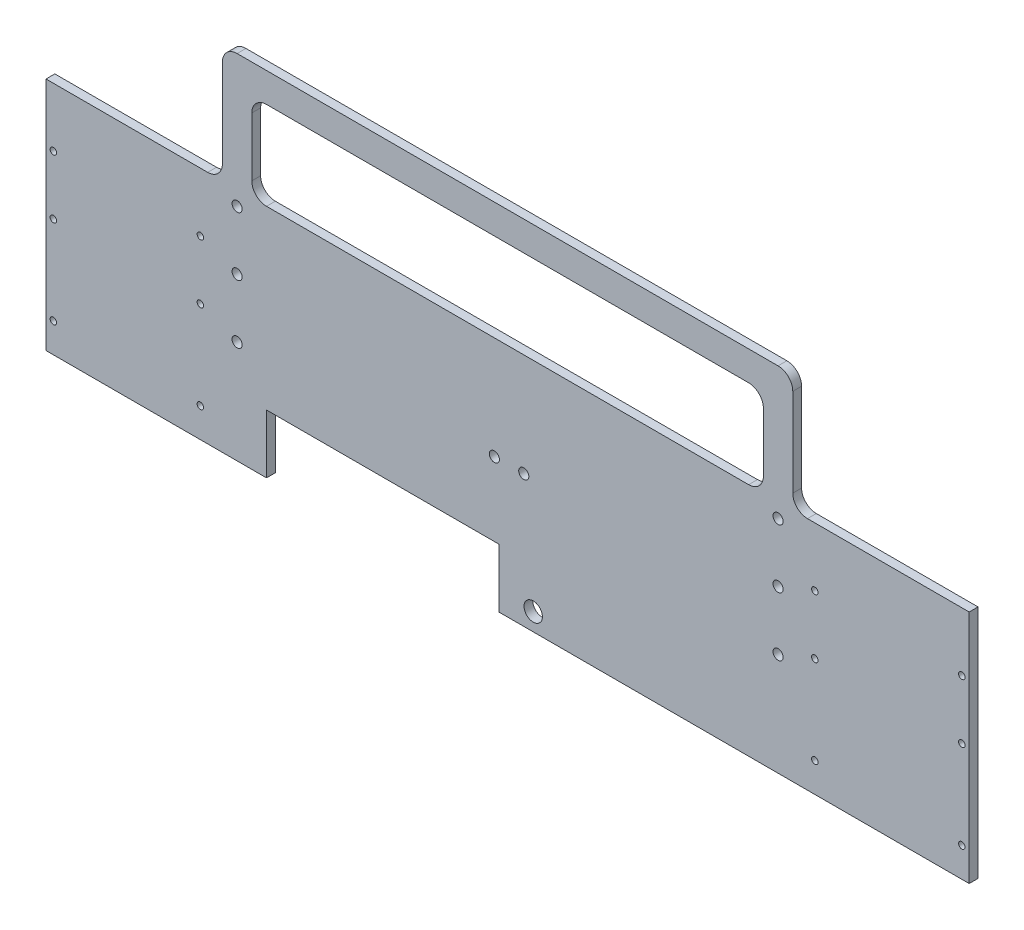
from build123d import *

# Parameters (mm, degrees)
SKETCH1_W                            = 398.78
SKETCH1_H                            = 101.6
BOSS_EXTRUDE1_DEPTH                  = 3.81
BOSS_EXTRUDE2_DEPTH                  = 3.81
FILLET1_R                            = 6.35
SKETCH11_W                           = 100.33
SKETCH11_H                           = 25.4
CUT_EXTRUDE1_DEPTH                   = 224.815656736
F_5_16_0_3125_DIAMETER_HOLE1_D       = 7.9375
F_11_64_0_17188_DIAMETER_HOLE1_D     = 4.365752
F_35_0_11_DIAMETER_HOLE1_D           = 2.794
F_35_0_11_DIAMETER_HOLE1_DEPTH       = 8.89
F_35_0_11_DIAMETER_HOLE1_TIP         = 0.839402285
F_11_64_0_17188_DIAMETER_HOLE2_D     = 4.365752
F_11_64_0_17188_DIAMETER_HOLE2_DEPTH = 8.89
F_11_64_0_17188_DIAMETER_HOLE2_TIP   = 1.311604225


with BuildPart() as part:
    # Sketch1 → Boss-Extrude1 (new body)
    with BuildSketch(Plane.XY):
        Rectangle(SKETCH1_W, SKETCH1_H)
    extrude(amount=BOSS_EXTRUDE1_DEPTH)

    # Sketch10 → Boss-Extrude2 (add)
    with BuildSketch(Plane.XY.offset(3.81)):
        Polygon((-123.19, 50.8), (-110.49, 50.8), (-110.49, 88.9), (110.49, 88.9), (110.49, 50.8), (123.19, 50.8), (123.19, 101.6), (-123.19, 101.6), align=None)
    extrude(amount=-BOSS_EXTRUDE2_DEPTH)

    # Fillet1
    fillet1_edges = [part.edges().sort_by_distance(p)[0] for p in [
        (123.19, 101.6, 1.905),
        (-123.19, 101.6, 1.905),
        (-123.19, 50.8, 1.905),
        (123.19, 50.8, 1.905),
        (110.49, 88.9, 1.905),
        (110.49, 50.8, 1.905),
        (-110.49, 50.8, 1.905),
        (-110.49, 88.9, 1.905),
    ]]
    fillet(fillet1_edges, radius=FILLET1_R)

    # Sketch11 → Cut-Extrude1 (cut, through all)
    with BuildSketch(Plane.XY.offset(3.81)):
        with Locations((-53.975, -38.1)):
            Rectangle(SKETCH11_W, SKETCH11_H)
    extrude(amount=-CUT_EXTRUDE1_DEPTH, mode=Mode.SUBTRACT)

    # 5/16 (0.3125) Diameter Hole1 (through all)
    with Locations(Plane.XY.offset(3.81)):
        with Locations((11.074908, -43.18)):
            Hole(F_5_16_0_3125_DIAMETER_HOLE1_D / 2)

    # 11/64 (0.17188) Diameter Hole1 (through all)
    with Locations(Plane.XY.offset(3.81)):
        with Locations((-116.84, 44.45), (-116.84, 19.05), (116.84, 44.45), (116.84, 19.05), (-116.84, -6.35), (116.84, -6.35)):
            Hole(F_11_64_0_17188_DIAMETER_HOLE1_D / 2)

    # #35 (0.11) Diameter Hole1
    with Locations(Plane.XY.offset(3.81)):
        with Locations((-196.215, 25.4), (-132.715, 25.4), (-132.715, 0), (-196.215, 0), (-196.215, -38.1), (-132.715, -38.1), (132.715, -38.1), (196.215, -38.1), (196.215, 0), (196.215, 25.4), (132.715, 25.4), (132.715, 0)):
            Hole(F_35_0_11_DIAMETER_HOLE1_D / 2, depth=F_35_0_11_DIAMETER_HOLE1_DEPTH)
            with Locations((0, 0, -(F_35_0_11_DIAMETER_HOLE1_DEPTH + F_35_0_11_DIAMETER_HOLE1_TIP / 2))):  # 118° drill point
                Cone(0, F_35_0_11_DIAMETER_HOLE1_D / 2, F_35_0_11_DIAMETER_HOLE1_TIP, mode=Mode.SUBTRACT)

    # 11/64 (0.17188) Diameter Hole2
    with Locations(Plane.XY.offset(3.81)):
        with Locations((-5.715, 6.35), (6.985, 6.35)):
            Hole(F_11_64_0_17188_DIAMETER_HOLE2_D / 2, depth=F_11_64_0_17188_DIAMETER_HOLE2_DEPTH)
            with Locations((0, 0, -(F_11_64_0_17188_DIAMETER_HOLE2_DEPTH + F_11_64_0_17188_DIAMETER_HOLE2_TIP / 2))):  # 118° drill point
                Cone(0, F_11_64_0_17188_DIAMETER_HOLE2_D / 2, F_11_64_0_17188_DIAMETER_HOLE2_TIP, mode=Mode.SUBTRACT)


solid = part.part
